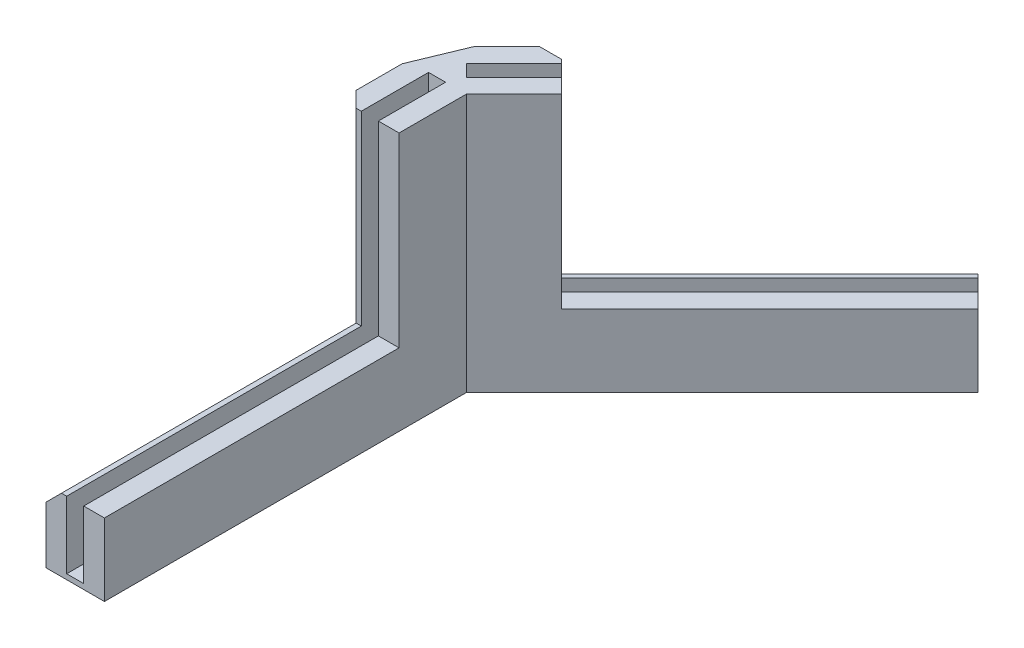
from build123d import *

# Parameters (mm, degrees)
BOSS_EXTRUDE1_DEPTH = 50
SKETCH3_W           = 3.3
SKETCH3_H           = 1
BOSS_EXTRUDE2_DEPTH = 13
BOSS_EXTRUDE3_DEPTH = 57
CHAMFER1_START      = -14
CHAMFER1_OUTLINE_W  = 52
CHAMFER1_OUTLINE_H  = 13
CHAMFER1_DEPTH      = 3.182909169
CHAMFER2_SIZE       = 3


with BuildPart() as part:
    # Sketch2 → Boss-Extrude1 (new body)
    with BuildSketch(Plane(origin=(0, 0, 0), x_dir=(1, 0, 0), z_dir=(0, 1, 0))):
        Polygon((-1.7, -2), (-1.7, -15), (-5.7, -15), (-5.7, -2), (-9, -2), (-9, -15), (-13, -15), (-13, 2.680601608), align=None)
    extrude(amount=BOSS_EXTRUDE1_DEPTH)

    # Sketch3 → Boss-Extrude2 (add)
    with BuildSketch(Plane.XY.offset(2)):
        with Locations((-7.35, 0.5)):
            Rectangle(SKETCH3_W, SKETCH3_H)
    extrude(amount=BOSS_EXTRUDE2_DEPTH)

    # Sketch5 → Boss-Extrude3 (add)
    with BuildSketch(Plane.XY.offset(15)):
        Polygon((-13, 0), (-1.7, 0), (-1.7, 14), (-5.7, 14), (-5.7, 1), (-9, 1), (-9, 14), (-13, 14), align=None)
    extrude(amount=BOSS_EXTRUDE3_DEPTH)

    # Mirror1: part across plane


with BuildPart() as part_1:
    add(part.part)
    add(part.part.mirror(Plane(origin=(-0.956063716, 0, 2.308147732), x_dir=(0.9238798691632129, 0, 0.38268261961443256), z_dir=(0.3826826196144326, 0, -0.9238798691632131))))

    # Chamfer1: read off the stored shape, not the designer's step
    # Chamfer1 outline → Chamfer1 (cut)
    with BuildSketch(Plane(origin=(0, 0, 0), x_dir=(0, 1, 0), z_dir=(0.9238798691632129, 0, 0.38268261961443295)).offset(CHAMFER1_START)):
        with Locations((25, 2.5)):
            Rectangle(CHAMFER1_OUTLINE_W, CHAMFER1_OUTLINE_H)
    extrude(amount=CHAMFER1_DEPTH, mode=Mode.SUBTRACT)

    # Chamfer2
    chamfer2_edges = [part_1.edges().sort_by_distance(p)[0] for p in [
        (-13, 32, 15),
        (-13, 14, 43.5),
        (-0.497948704, 32, -15.182696898),
        (19.654559103, 14, -35.335275619),
    ]]
    chamfer(chamfer2_edges, length=CHAMFER2_SIZE)


solid = part_1.part
